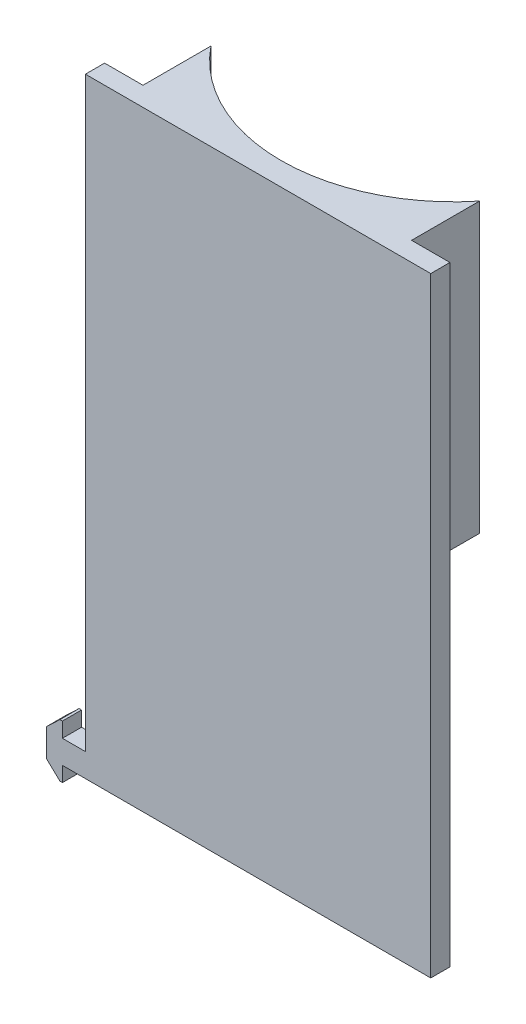
from build123d import *

# Parameters (mm, degrees)
BOSS_EXTRUDE1_DEPTH = 5
BOSS_EXTRUDE2_DEPTH = 75


with BuildPart() as part:
    # Sketch2 → Boss-Extrude1 (new body)
    with BuildSketch(Plane.XY):
        Polygon((-5.152414984, -3.618325464), (-1.641080211, -6.95), (-1, -6.95), (-1, -3.05), (95, -3.05), (95, 155.95), (5, 155.95), (5, 3.05), (-1, 3.05), (-1, 6.95), (-1.641080211, 6.95), (-5.152414984, 3.618325464), align=None)
    extrude(amount=-BOSS_EXTRUDE1_DEPTH)

    # Sketch3 → Boss-Extrude2 (add)
    with BuildSketch(Plane(origin=(0, 155.95, 0), x_dir=(1, 0, 0), z_dir=(0, 1, 0))):
        with BuildLine():
            ThreePointArc((85, 22.715728753), (50, 6), (15, 22.715728753))
            Line((15, 22.715728753), (15, 5))
            Line((15, 5), (85, 5))
            Line((85, 5), (85, 22.715728753))
        make_face()
    extrude(amount=-BOSS_EXTRUDE2_DEPTH)


solid = part.part
